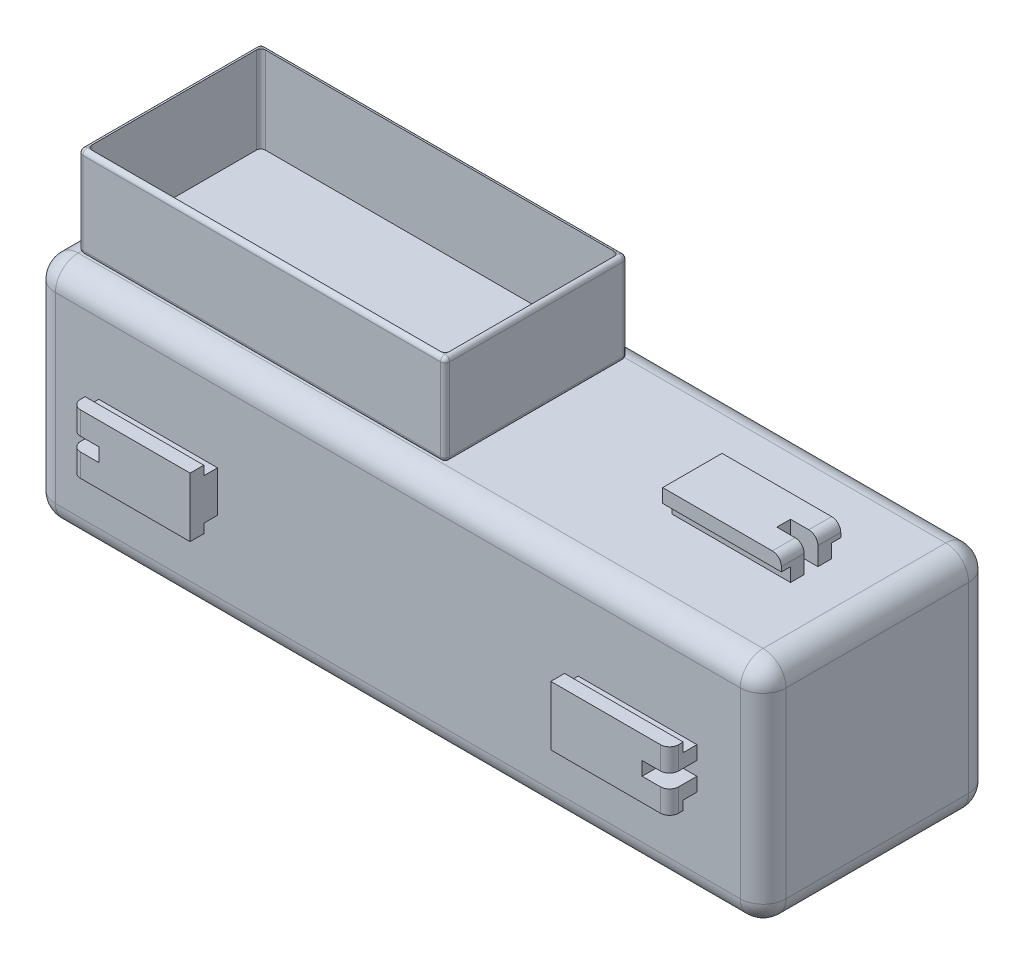
from build123d import *

# Parameters (mm, degrees)
SKETCH1_W               = 160
SKETCH1_H               = 50
BOSS_EXTRUDE1_DEPTH     = 25
SKETCH2_W               = 26
SKETCH2_H               = 13
CONNECTOR_BASE_DEPTH    = 6
SKETCH3_W               = 2
SKETCH3_H               = 3
DOVETAIL_CUT_DEPTH      = 151.851748415
FILLET1_R               = 2
SKETCH4_W               = 3
SKETCH4_H               = 6
CUT_EXTRUDE1_DEPTH      = 6
CIRPATTERN1_START       = -4.5
CIRPATTERN1_OUTLINE_W   = 20
CIRPATTERN1_OUTLINE_H   = 6
CIRPATTERN1_DEPTH       = 9
CIRPATTERN1_START_2     = -6.5
CIRPATTERN1_2_OUTLINE_W = 20
CIRPATTERN1_2_OUTLINE_H = 3
CIRPATTERN1_2_DEPTH     = 13
CIRPATTERN1_3_DEPTH     = 3
CIRPATTERN1_START_3     = 1.5
CIRPATTERN1_4_DEPTH     = 3
CIRPATTERN1_5_DEPTH     = 2
CIRPATTERN1_START_4     = 4.5
CIRPATTERN1_6_DEPTH     = 2
CIRPATTERN1_7_OUTLINE_W = 20
CIRPATTERN1_7_OUTLINE_H = 6
CIRPATTERN1_7_DEPTH     = 9
CIRPATTERN1_8_OUTLINE_W = 20
CIRPATTERN1_8_OUTLINE_H = 3
CIRPATTERN1_8_DEPTH     = 13
CIRPATTERN1_9_DEPTH     = 3
CIRPATTERN1_10_DEPTH    = 3
CIRPATTERN1_11_DEPTH    = 2
CIRPATTERN1_12_DEPTH    = 2
MIRROR1_START           = -4.5
MIRROR1_OUTLINE_W       = 20
MIRROR1_OUTLINE_H       = 6
MIRROR1_DEPTH           = 9
MIRROR1_START_2         = -6.5
MIRROR1_2_OUTLINE_W     = 20
MIRROR1_2_OUTLINE_H     = 3
MIRROR1_2_DEPTH         = 13
MIRROR1_3_DEPTH         = 3
MIRROR1_START_3         = 1.5
MIRROR1_4_DEPTH         = 3
MIRROR1_5_DEPTH         = 2
MIRROR1_START_4         = 4.5
MIRROR1_6_DEPTH         = 2
MIRROR1_7_OUTLINE_W     = 20
MIRROR1_7_OUTLINE_H     = 6
MIRROR1_7_DEPTH         = 9
MIRROR1_8_OUTLINE_W     = 20
MIRROR1_8_OUTLINE_H     = 3
MIRROR1_8_DEPTH         = 13
MIRROR1_9_DEPTH         = 3
MIRROR1_10_DEPTH        = 3
MIRROR1_11_DEPTH        = 2
MIRROR1_12_DEPTH        = 2
FILLET2_R               = 5
SKETCH5_W               = 26
SKETCH5_H               = 13
CUT_EXTRUDE2_DEPTH      = 103.454868113
SKETCH6_W               = 80.339783693
SKETCH6_H               = 40
BOSS_EXTRUDE2_DEPTH     = 20
SHELL1_T                = -1
FILLET3_R               = 1
FILLET4_R               = 1


# Read off the part's stored shape, not the designer's step: CirPattern1, Mirror1
with BuildPart() as part:
    # Sketch1 → Boss-Extrude1 (new, symmetric)
    with BuildSketch(Plane(origin=(0, 0, 0), x_dir=(1, 0, 0), z_dir=(0, 1, 0))):
        Rectangle(SKETCH1_W, SKETCH1_H)
    extrude(amount=BOSS_EXTRUDE1_DEPTH, both=True)

    # Sketch2 → connector base (add)
    with BuildSketch(Plane(origin=(0, 25, 0), x_dir=(1, 0, 0), z_dir=(0, 1, 0))):
        with Locations((-52.5, 0)):
            Rectangle(SKETCH2_W, SKETCH2_H)
    extrude(amount=CONNECTOR_BASE_DEPTH)

    # Sketch3 → dovetail cut (cut, through all)
    with BuildSketch(Plane.ZY.offset(65.5)):
        with Locations((5.5, 26.5)):
            Rectangle(SKETCH3_W, SKETCH3_H)
        with Locations((-5.5, 26.5)):
            Rectangle(SKETCH3_W, SKETCH3_H)
    extrude(amount=-DOVETAIL_CUT_DEPTH, mode=Mode.SUBTRACT)

    # Fillet1
    fillet1_edges = [part.edges().sort_by_distance(p)[0] for p in [
        (-65.5, 31, 0),
    ]]
    fillet(fillet1_edges, radius=FILLET1_R)

    # Sketch4 → Cut-Extrude1 (cut)
    with BuildSketch(Plane.ZY.offset(65.5)):
        with Locations((0, 28)):
            Rectangle(SKETCH4_W, SKETCH4_H)
    extrude(amount=-CUT_EXTRUDE1_DEPTH, mode=Mode.SUBTRACT)

    # CirPattern1 outline → CirPattern1 (add)
    with BuildSketch(Plane(origin=(0, 0, 0), x_dir=(1, 0, 0), z_dir=(0, 1, 0)).offset(CIRPATTERN1_START)):
        with Locations((-49.5, 28)):
            Rectangle(CIRPATTERN1_OUTLINE_W, CIRPATTERN1_OUTLINE_H)
        with Locations((-49.5, -28)):
            Rectangle(CIRPATTERN1_OUTLINE_W, CIRPATTERN1_OUTLINE_H)
    extrude(amount=CIRPATTERN1_DEPTH)

    # CirPattern1 2 outline → CirPattern1 2 (add)
    with BuildSketch(Plane(origin=(0, 0, 0), x_dir=(1, 0, 0), z_dir=(0, 1, 0)).offset(CIRPATTERN1_START_2)):
        with Locations((-49.5, 29.5)):
            Rectangle(CIRPATTERN1_2_OUTLINE_W, CIRPATTERN1_2_OUTLINE_H)
        with Locations((-49.5, -29.5)):
            Rectangle(CIRPATTERN1_2_OUTLINE_W, CIRPATTERN1_2_OUTLINE_H)
    extrude(amount=CIRPATTERN1_2_DEPTH)

    # CirPattern1 3 outline → CirPattern1 3 (add)
    with BuildSketch(Plane(origin=(0, 0, 0), x_dir=(1, 0, 0), z_dir=(0, 1, 0)).offset(CIRPATTERN1_START)):
        with BuildLine():
            Line((-65.5, 25), (-59.5, 25))
            Line((-59.5, 25), (-59.5, 31))
            Line((-59.5, 31), (-63.5, 31))
            ThreePointArc((-63.5, 31), (-64.914213562, 30.414213562), (-65.5, 29))
            Line((-65.5, 29), (-65.5, 25))
        make_face()
        with BuildLine():
            ThreePointArc((-65.5, -29), (-64.914213562, -30.414213562), (-63.5, -31))
            Line((-63.5, -31), (-59.5, -31))
            Line((-59.5, -31), (-59.5, -25))
            Line((-59.5, -25), (-65.5, -25))
            Line((-65.5, -25), (-65.5, -29))
        make_face()
    extrude(amount=CIRPATTERN1_3_DEPTH)

    # CirPattern1 4 outline → CirPattern1 4 (add)
    with BuildSketch(Plane(origin=(0, 0, 0), x_dir=(1, 0, 0), z_dir=(0, 1, 0)).offset(CIRPATTERN1_START_3)):
        with BuildLine():
            Line((-65.5, 25), (-59.5, 25))
            Line((-59.5, 25), (-59.5, 31))
            Line((-59.5, 31), (-63.5, 31))
            ThreePointArc((-63.5, 31), (-64.914213562, 30.414213562), (-65.5, 29))
            Line((-65.5, 29), (-65.5, 25))
        make_face()
        with BuildLine():
            ThreePointArc((-65.5, -29), (-64.914213562, -30.414213562), (-63.5, -31))
            Line((-63.5, -31), (-59.5, -31))
            Line((-59.5, -31), (-59.5, -25))
            Line((-59.5, -25), (-65.5, -25))
            Line((-65.5, -25), (-65.5, -29))
        make_face()
    extrude(amount=CIRPATTERN1_4_DEPTH)

    # CirPattern1 5 outline → CirPattern1 5 (add)
    with BuildSketch(Plane(origin=(0, 0, 0), x_dir=(1, 0, 0), z_dir=(0, 1, 0)).offset(CIRPATTERN1_START_2)):
        with BuildLine():
            Line((-65.5, 29), (-65.5, 28))
            Line((-65.5, 28), (-59.5, 28))
            Line((-59.5, 28), (-59.5, 31))
            Line((-59.5, 31), (-63.5, 31))
            ThreePointArc((-63.5, 31), (-64.914213562, 30.414213562), (-65.5, 29))
        make_face()
        with BuildLine():
            Line((-65.5, -28), (-65.5, -29))
            ThreePointArc((-65.5, -29), (-64.914213562, -30.414213562), (-63.5, -31))
            Line((-63.5, -31), (-59.5, -31))
            Line((-59.5, -31), (-59.5, -28))
            Line((-59.5, -28), (-65.5, -28))
        make_face()
    extrude(amount=CIRPATTERN1_5_DEPTH)

    # CirPattern1 6 outline → CirPattern1 6 (add)
    with BuildSketch(Plane(origin=(0, 0, 0), x_dir=(1, 0, 0), z_dir=(0, 1, 0)).offset(CIRPATTERN1_START_4)):
        with BuildLine():
            Line((-65.5, 29), (-65.5, 28))
            Line((-65.5, 28), (-59.5, 28))
            Line((-59.5, 28), (-59.5, 31))
            Line((-59.5, 31), (-63.5, 31))
            ThreePointArc((-63.5, 31), (-64.914213562, 30.414213562), (-65.5, 29))
        make_face()
        with BuildLine():
            Line((-65.5, -28), (-65.5, -29))
            ThreePointArc((-65.5, -29), (-64.914213562, -30.414213562), (-63.5, -31))
            Line((-63.5, -31), (-59.5, -31))
            Line((-59.5, -31), (-59.5, -28))
            Line((-59.5, -28), (-65.5, -28))
        make_face()
    extrude(amount=CIRPATTERN1_6_DEPTH)

    # CirPattern1 7 outline → CirPattern1 7 (add)
    with BuildSketch(Plane.XY.offset(CIRPATTERN1_START)):
        with Locations((-49.5, -28)):
            Rectangle(CIRPATTERN1_7_OUTLINE_W, CIRPATTERN1_7_OUTLINE_H)
    extrude(amount=CIRPATTERN1_7_DEPTH)

    # CirPattern1 8 outline → CirPattern1 8 (add)
    with BuildSketch(Plane.XY.offset(CIRPATTERN1_START_2)):
        with Locations((-49.5, -29.5)):
            Rectangle(CIRPATTERN1_8_OUTLINE_W, CIRPATTERN1_8_OUTLINE_H)
    extrude(amount=CIRPATTERN1_8_DEPTH)

    # CirPattern1 9 outline → CirPattern1 9 (add)
    with BuildSketch(Plane.XY.offset(CIRPATTERN1_START)):
        with BuildLine():
            ThreePointArc((-65.5, -29), (-64.914213562, -30.414213562), (-63.5, -31))
            Line((-63.5, -31), (-59.5, -31))
            Line((-59.5, -31), (-59.5, -25))
            Line((-59.5, -25), (-65.5, -25))
            Line((-65.5, -25), (-65.5, -29))
        make_face()
    extrude(amount=CIRPATTERN1_9_DEPTH)

    # CirPattern1 10 outline → CirPattern1 10 (add)
    with BuildSketch(Plane.XY.offset(CIRPATTERN1_START_3)):
        with BuildLine():
            ThreePointArc((-65.5, -29), (-64.914213562, -30.414213562), (-63.5, -31))
            Line((-63.5, -31), (-59.5, -31))
            Line((-59.5, -31), (-59.5, -25))
            Line((-59.5, -25), (-65.5, -25))
            Line((-65.5, -25), (-65.5, -29))
        make_face()
    extrude(amount=CIRPATTERN1_10_DEPTH)

    # CirPattern1 11 outline → CirPattern1 11 (add)
    with BuildSketch(Plane.XY.offset(CIRPATTERN1_START_2)):
        with BuildLine():
            Line((-65.5, -28), (-65.5, -29))
            ThreePointArc((-65.5, -29), (-64.914213562, -30.414213562), (-63.5, -31))
            Line((-63.5, -31), (-59.5, -31))
            Line((-59.5, -31), (-59.5, -28))
            Line((-59.5, -28), (-65.5, -28))
        make_face()
    extrude(amount=CIRPATTERN1_11_DEPTH)

    # CirPattern1 12 outline → CirPattern1 12 (add)
    with BuildSketch(Plane.XY.offset(CIRPATTERN1_START_4)):
        with BuildLine():
            Line((-65.5, -28), (-65.5, -29))
            ThreePointArc((-65.5, -29), (-64.914213562, -30.414213562), (-63.5, -31))
            Line((-63.5, -31), (-59.5, -31))
            Line((-59.5, -31), (-59.5, -28))
            Line((-59.5, -28), (-65.5, -28))
        make_face()
    extrude(amount=CIRPATTERN1_12_DEPTH)

    # Mirror1 outline → Mirror1 (add)
    with BuildSketch(Plane.XY.offset(MIRROR1_START)):
        with Locations((49.5, 28)):
            Rectangle(MIRROR1_OUTLINE_W, MIRROR1_OUTLINE_H)
        with Locations((49.5, -28)):
            Rectangle(MIRROR1_OUTLINE_W, MIRROR1_OUTLINE_H)
    extrude(amount=MIRROR1_DEPTH)

    # Mirror1 2 outline → Mirror1 2 (add)
    with BuildSketch(Plane.XY.offset(MIRROR1_START_2)):
        with Locations((49.5, 29.5)):
            Rectangle(MIRROR1_2_OUTLINE_W, MIRROR1_2_OUTLINE_H)
        with Locations((49.5, -29.5)):
            Rectangle(MIRROR1_2_OUTLINE_W, MIRROR1_2_OUTLINE_H)
    extrude(amount=MIRROR1_2_DEPTH)

    # Mirror1 3 outline → Mirror1 3 (add)
    with BuildSketch(Plane.XY.offset(MIRROR1_START)):
        with BuildLine():
            Line((59.5, 25), (65.5, 25))
            Line((65.5, 25), (65.5, 29))
            ThreePointArc((65.5, 29), (64.914213562, 30.414213562), (63.5, 31))
            Line((63.5, 31), (59.5, 31))
            Line((59.5, 31), (59.5, 25))
        make_face()
        with BuildLine():
            ThreePointArc((63.5, -31), (64.914213562, -30.414213562), (65.5, -29))
            Line((65.5, -29), (65.5, -25))
            Line((65.5, -25), (59.5, -25))
            Line((59.5, -25), (59.5, -31))
            Line((59.5, -31), (63.5, -31))
        make_face()
    extrude(amount=MIRROR1_3_DEPTH)

    # Mirror1 4 outline → Mirror1 4 (add)
    with BuildSketch(Plane.XY.offset(MIRROR1_START_3)):
        with BuildLine():
            Line((59.5, 25), (65.5, 25))
            Line((65.5, 25), (65.5, 29))
            ThreePointArc((65.5, 29), (64.914213562, 30.414213562), (63.5, 31))
            Line((63.5, 31), (59.5, 31))
            Line((59.5, 31), (59.5, 25))
        make_face()
        with BuildLine():
            ThreePointArc((63.5, -31), (64.914213562, -30.414213562), (65.5, -29))
            Line((65.5, -29), (65.5, -25))
            Line((65.5, -25), (59.5, -25))
            Line((59.5, -25), (59.5, -31))
            Line((59.5, -31), (63.5, -31))
        make_face()
    extrude(amount=MIRROR1_4_DEPTH)

    # Mirror1 5 outline → Mirror1 5 (add)
    with BuildSketch(Plane.XY.offset(MIRROR1_START_2)):
        with BuildLine():
            Line((59.5, 28), (65.5, 28))
            Line((65.5, 28), (65.5, 29))
            ThreePointArc((65.5, 29), (64.914213562, 30.414213562), (63.5, 31))
            Line((63.5, 31), (59.5, 31))
            Line((59.5, 31), (59.5, 28))
        make_face()
        with BuildLine():
            ThreePointArc((63.5, -31), (64.914213562, -30.414213562), (65.5, -29))
            Line((65.5, -29), (65.5, -28))
            Line((65.5, -28), (59.5, -28))
            Line((59.5, -28), (59.5, -31))
            Line((59.5, -31), (63.5, -31))
        make_face()
    extrude(amount=MIRROR1_5_DEPTH)

    # Mirror1 6 outline → Mirror1 6 (add)
    with BuildSketch(Plane.XY.offset(MIRROR1_START_4)):
        with BuildLine():
            Line((59.5, 28), (65.5, 28))
            Line((65.5, 28), (65.5, 29))
            ThreePointArc((65.5, 29), (64.914213562, 30.414213562), (63.5, 31))
            Line((63.5, 31), (59.5, 31))
            Line((59.5, 31), (59.5, 28))
        make_face()
        with BuildLine():
            ThreePointArc((63.5, -31), (64.914213562, -30.414213562), (65.5, -29))
            Line((65.5, -29), (65.5, -28))
            Line((65.5, -28), (59.5, -28))
            Line((59.5, -28), (59.5, -31))
            Line((59.5, -31), (63.5, -31))
        make_face()
    extrude(amount=MIRROR1_6_DEPTH)

    # Mirror1 7 outline → Mirror1 7 (add)
    with BuildSketch(Plane(origin=(0, 0, 0), x_dir=(1, 0, 0), z_dir=(0, 1, 0)).offset(MIRROR1_START)):
        with Locations((49.5, 28)):
            Rectangle(MIRROR1_7_OUTLINE_W, MIRROR1_7_OUTLINE_H)
        with Locations((49.5, -28)):
            Rectangle(MIRROR1_7_OUTLINE_W, MIRROR1_7_OUTLINE_H)
    extrude(amount=MIRROR1_7_DEPTH)

    # Mirror1 8 outline → Mirror1 8 (add)
    with BuildSketch(Plane(origin=(0, 0, 0), x_dir=(1, 0, 0), z_dir=(0, 1, 0)).offset(MIRROR1_START_2)):
        with Locations((49.5, 29.5)):
            Rectangle(MIRROR1_8_OUTLINE_W, MIRROR1_8_OUTLINE_H)
        with Locations((49.5, -29.5)):
            Rectangle(MIRROR1_8_OUTLINE_W, MIRROR1_8_OUTLINE_H)
    extrude(amount=MIRROR1_8_DEPTH)

    # Mirror1 9 outline → Mirror1 9 (add)
    with BuildSketch(Plane(origin=(0, 0, 0), x_dir=(1, 0, 0), z_dir=(0, 1, 0)).offset(MIRROR1_START)):
        with BuildLine():
            Line((59.5, 25), (65.5, 25))
            Line((65.5, 25), (65.5, 29))
            ThreePointArc((65.5, 29), (64.914213562, 30.414213562), (63.5, 31))
            Line((63.5, 31), (59.5, 31))
            Line((59.5, 31), (59.5, 25))
        make_face()
        with BuildLine():
            ThreePointArc((63.5, -31), (64.914213562, -30.414213562), (65.5, -29))
            Line((65.5, -29), (65.5, -25))
            Line((65.5, -25), (59.5, -25))
            Line((59.5, -25), (59.5, -31))
            Line((59.5, -31), (63.5, -31))
        make_face()
    extrude(amount=MIRROR1_9_DEPTH)

    # Mirror1 10 outline → Mirror1 10 (add)
    with BuildSketch(Plane(origin=(0, 0, 0), x_dir=(1, 0, 0), z_dir=(0, 1, 0)).offset(MIRROR1_START_3)):
        with BuildLine():
            Line((59.5, 25), (65.5, 25))
            Line((65.5, 25), (65.5, 29))
            ThreePointArc((65.5, 29), (64.914213562, 30.414213562), (63.5, 31))
            Line((63.5, 31), (59.5, 31))
            Line((59.5, 31), (59.5, 25))
        make_face()
        with BuildLine():
            ThreePointArc((63.5, -31), (64.914213562, -30.414213562), (65.5, -29))
            Line((65.5, -29), (65.5, -25))
            Line((65.5, -25), (59.5, -25))
            Line((59.5, -25), (59.5, -31))
            Line((59.5, -31), (63.5, -31))
        make_face()
    extrude(amount=MIRROR1_10_DEPTH)

    # Mirror1 11 outline → Mirror1 11 (add)
    with BuildSketch(Plane(origin=(0, 0, 0), x_dir=(1, 0, 0), z_dir=(0, 1, 0)).offset(MIRROR1_START_2)):
        with BuildLine():
            Line((59.5, 28), (65.5, 28))
            Line((65.5, 28), (65.5, 29))
            ThreePointArc((65.5, 29), (64.914213562, 30.414213562), (63.5, 31))
            Line((63.5, 31), (59.5, 31))
            Line((59.5, 31), (59.5, 28))
        make_face()
        with BuildLine():
            ThreePointArc((63.5, -31), (64.914213562, -30.414213562), (65.5, -29))
            Line((65.5, -29), (65.5, -28))
            Line((65.5, -28), (59.5, -28))
            Line((59.5, -28), (59.5, -31))
            Line((59.5, -31), (63.5, -31))
        make_face()
    extrude(amount=MIRROR1_11_DEPTH)

    # Mirror1 12 outline → Mirror1 12 (add)
    with BuildSketch(Plane(origin=(0, 0, 0), x_dir=(1, 0, 0), z_dir=(0, 1, 0)).offset(MIRROR1_START_4)):
        with BuildLine():
            Line((59.5, 28), (65.5, 28))
            Line((65.5, 28), (65.5, 29))
            ThreePointArc((65.5, 29), (64.914213562, 30.414213562), (63.5, 31))
            Line((63.5, 31), (59.5, 31))
            Line((59.5, 31), (59.5, 28))
        make_face()
        with BuildLine():
            ThreePointArc((63.5, -31), (64.914213562, -30.414213562), (65.5, -29))
            Line((65.5, -29), (65.5, -28))
            Line((65.5, -28), (59.5, -28))
            Line((59.5, -28), (59.5, -31))
            Line((59.5, -31), (63.5, -31))
        make_face()
    extrude(amount=MIRROR1_12_DEPTH)

    # Fillet2
    fillet2_edges = [part.edges().sort_by_distance(p)[0] for p in [
        (80, 25, 0),
        (0, 25, -25),
        (-80, 25, 0),
        (0, -25, -25),
        (80, -25, 0),
        (0, -25, 25),
        (-80, -25, 0),
        (-80, 0, -25),
        (80, 0, -25),
        (80, 0, 25),
        (-80, 0, 25),
        (0, 25, 25),
    ]]
    fillet(fillet2_edges, radius=FILLET2_R)

    # Sketch5 → Cut-Extrude2 (cut, through all)
    with BuildSketch(Plane(origin=(0, 25, 0), x_dir=(1, 0, 0), z_dir=(0, 1, 0))):
        with Locations((-52.5, 0)):
            Rectangle(SKETCH5_W, SKETCH5_H)
    extrude(amount=CUT_EXTRUDE2_DEPTH, mode=Mode.SUBTRACT)


with BuildPart() as body_2:
    # Sketch6 → Boss-Extrude2 (new body)
    with BuildSketch(Plane(origin=(0, 25, 0), x_dir=(1, 0, 0), z_dir=(0, 1, 0))):
        with Locations((-34.830108153, 0)):
            Rectangle(SKETCH6_W, SKETCH6_H)
    extrude(amount=BOSS_EXTRUDE2_DEPTH)

    # Shell1
    shell1_openings = [body_2.faces().sort_by_distance(p)[0] for p in [
        (-34.830108153, 45, 0),
    ]]
    offset(amount=SHELL1_T, openings=shell1_openings, kind=Kind.INTERSECTION)

    # Fillet3
    fillet3_edges = [body_2.edges().sort_by_distance(p)[0] for p in [
        (-74, 35.5, -19),
        (-74, 35.5, 19),
        (4.339783693, 35.5, 19),
        (4.339783693, 35.5, -19),
        (-75, 35, -20),
        (5.339783693, 35, -20),
        (5.339783693, 35, 20),
        (-75, 35, 20),
    ]]
    fillet(fillet3_edges, radius=FILLET3_R)

    # Fillet4
    fillet4_edges = [body_2.edges().sort_by_distance(p)[0] for p in [
        (-75, 25, 0),
        (-75, 45, 0),
        (-34.830108153, 25, -20),
        (5.339783693, 25, 0),
        (-34.830108153, 25, 20),
        (-74.707106781, 25, 19.707106781),
        (5.046890474, 25, 19.707106781),
        (5.046890474, 25, -19.707106781),
        (-74.707106781, 25, -19.707106781),
        (-34.830108153, 45, -20),
        (-34.830108153, 45, 20),
        (5.339783693, 45, 0),
        (-74.707106781, 45, 19.707106781),
        (5.046890474, 45, 19.707106781),
        (5.046890474, 45, -19.707106781),
        (-74.707106781, 45, -19.707106781),
    ]]
    fillet(fillet4_edges, radius=FILLET4_R - 0.0001)  # a hair under: the kernel refuses the full size


solid = Compound([part.part, body_2.part])
